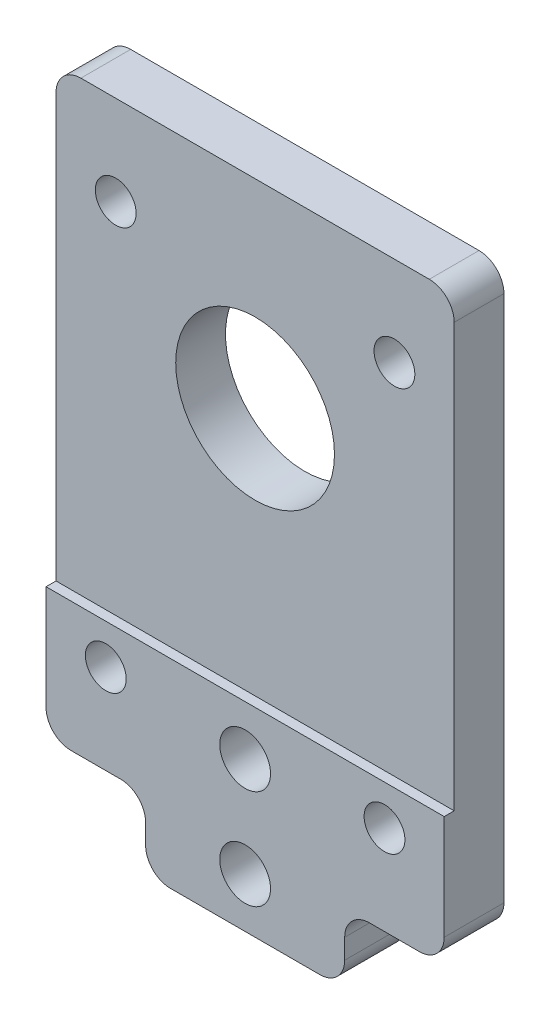
from build123d import *
from build123d.topology import SkipClean

# Parameters (mm, degrees)
SKETCH1_R           = 2.55
BOSS_EXTRUDE2_DEPTH = 6
SKETCH7_W           = 40
SKETCH7_H           = 58
BOSS_EXTRUDE3_DEPTH = 6
FILLET1_R           = 2.5
SKETCH3_R           = 7.975
CUT_EXTRUDE2_DEPTH  = 55.184868737
SKETCH2_R           = 2.05
CUT_EXTRUDE1_DEPTH  = 55.184868737
SKETCH6_W           = 60
SKETCH6_H           = 50
CUT_EXTRUDE5_DEPTH  = 1
SKETCH9_R           = 2.55
CUT_EXTRUDE7_DEPTH  = 55.184868737


with BuildPart() as part:
    # Sketch1 → Boss-Extrude2 (new body)
    with BuildSketch(Plane.XY):
        with BuildLine():
            Line((-10, -15), (-10, 15))
            Line((-10, 15), (-15, 30))
            ThreePointArc((-15, 30), (0, 45), (15, 30))
            Line((15, 30), (10, 15))
            Line((10, 15), (10, -15))
            Line((10, -15), (-10, -15))
        make_face()
        Circle(SKETCH1_R, mode=Mode.SUBTRACT)
        with Locations((0, -10)):
            Circle(SKETCH1_R, mode=Mode.SUBTRACT)
    extrude(amount=BOSS_EXTRUDE2_DEPTH)

    # Sketch7 → Boss-Extrude3 (add)
    with BuildSketch(Plane(origin=(0, 0, 0), x_dir=(-1, 0, 0), z_dir=(0, 0, -1))):
        with Locations((0, 21)):
            Rectangle(SKETCH7_W, SKETCH7_H)
    extrude(amount=-BOSS_EXTRUDE3_DEPTH)

    # Fillet1
    fillet1_edges = [part.edges().sort_by_distance(p)[0] for p in [
        (10, -15, 3),
        (-10, -15, 3),
        (20, 50, 3),
        (10, -8, 3),
        (20, -8, 3),
        (-20, 50, 3),
        (-20, -8, 3),
        (-10, -8, 3),
    ]]
    fillet(fillet1_edges, radius=FILLET1_R)

    # Sketch3 → Cut-Extrude2 (cut, through all)
    with BuildSketch(Plane.XY.offset(6)):
        with Locations((0, 30)):
            Circle(SKETCH3_R)
    extrude(amount=-CUT_EXTRUDE2_DEPTH, mode=Mode.SUBTRACT)

    # Sketch2 → Cut-Extrude1 (cut, through all)
    with BuildSketch(Plane.XY.offset(6)):
        with Locations((-14, 41)):
            Circle(SKETCH2_R)
        with Locations((14, 41)):
            Circle(SKETCH2_R)
        with Locations((14, 1)):
            Circle(SKETCH2_R)
        with Locations((-14, 1)):
            Circle(SKETCH2_R)
    extrude(amount=-CUT_EXTRUDE1_DEPTH, mode=Mode.SUBTRACT)

    # Sketch6 → Cut-Extrude5 (cut)
    with BuildSketch(Plane.XY.offset(6)):
        with Locations((0, 30)):
            Rectangle(SKETCH6_W, SKETCH6_H)
    extrude(amount=-CUT_EXTRUDE5_DEPTH, mode=Mode.SUBTRACT)

    # Sketch9 → Cut-Extrude7 (cut, through all)
    with SkipClean():  # the faces are left unmerged after this step: merging them gives an invalid solid
        with BuildSketch(Plane.XY.offset(6)):
            with Locations((0, -10)):
                Circle(SKETCH9_R)
            Circle(SKETCH9_R)
        extrude(amount=-CUT_EXTRUDE7_DEPTH, mode=Mode.SUBTRACT)


solid = part.part
